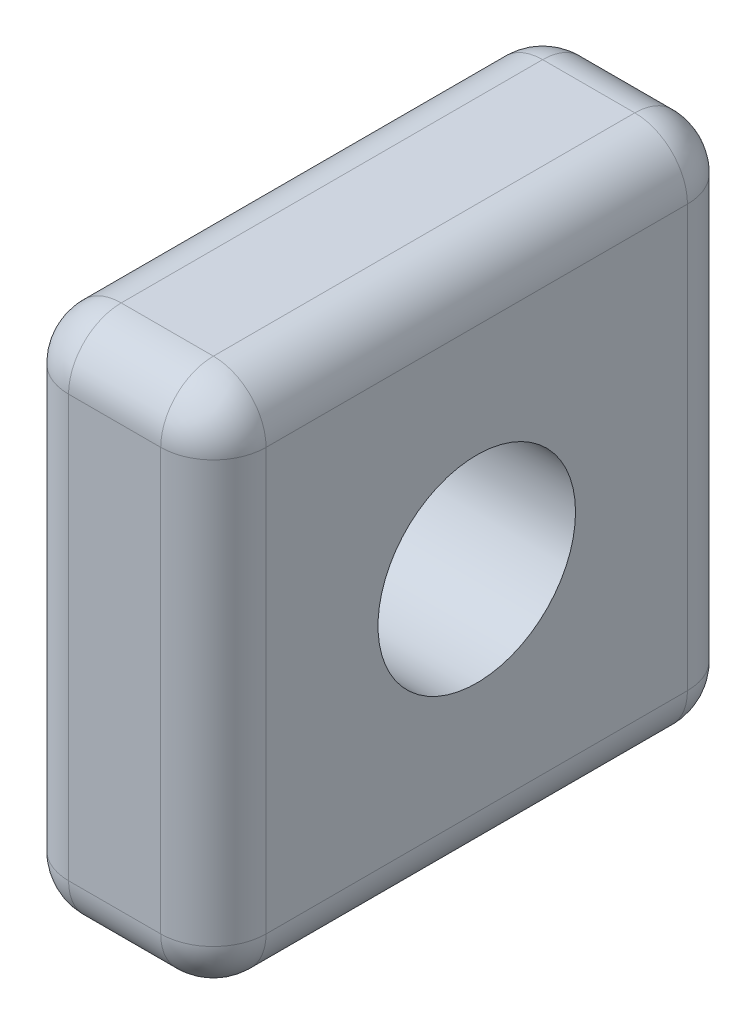
from build123d import *

# Parameters (mm, degrees)
SKETCH2_W           = 12.7
SKETCH2_H           = 12.7
BOSS_EXTRUDE4_DEPTH = 4.7625
SKETCH3_R           = 2.38125
CUT_EXTRUDE1_DEPTH  = 19.581211108
FILLET1_R           = 1.27
FILLET2_R           = 1.27


with BuildPart() as part:
    # Sketch2 → Boss-Extrude4 (new body)
    with BuildSketch(Plane(origin=(0, 0, 0), x_dir=(0, 0, -1), z_dir=(1, 0, 0))):
        with Locations((6.35, 6.35)):
            Rectangle(SKETCH2_W, SKETCH2_H)
    extrude(amount=BOSS_EXTRUDE4_DEPTH)

    # Sketch3 → Cut-Extrude1 (cut, through all)
    with BuildSketch(Plane(origin=(4.7625, 0, 0), x_dir=(0, 0, -1), z_dir=(1, 0, 0))):
        with Locations((6.35, 6.35)):
            Circle(SKETCH3_R)
    extrude(amount=-CUT_EXTRUDE1_DEPTH, mode=Mode.SUBTRACT)

    # Fillet1
    fillet1_edges = [part.edges().sort_by_distance(p)[0] for p in [
        (4.7625, 6.35, -12.7),
        (4.7625, 12.7, -6.35),
        (4.7625, 6.35, 0),
        (4.7625, 0, -6.35),
    ]]
    fillet(fillet1_edges, radius=FILLET1_R)

    # Fillet2
    # the kernel refuses this fillet: 1.27 mm, written as the material it takes off along each edge
    with BuildSketch(Plane(origin=(3.4925, 1.27, -1.27), x_dir=(0, 0, 1), z_dir=(0, -1, 0))) as fillet2_piece_1_section:
        Polygon((0, 0), (FILLET2_R, 0), (FILLET2_R, -FILLET2_R), (0, -FILLET2_R), align=None)
    fillet2_piece_1 = extrude(amount=FILLET2_R, mode=Mode.PRIVATE)
    fillet2_piece_1 = fillet2_piece_1 - Plane(origin=(3.4925, 1.27, -1.27), x_dir=(-0.7071067811865475, 0, -0.7071067811865475), z_dir=(0, -1, 0)) * Sphere(FILLET2_R, mode=Mode.PRIVATE)
    add(fillet2_piece_1, mode=Mode.SUBTRACT)
    with BuildSketch(Plane(origin=(3.4925, 11.43, -1.27), x_dir=(0, 1, 0), z_dir=(0, 0, 1))) as fillet2_piece_2_section:
        Polygon((0, 0), (FILLET2_R, 0), (FILLET2_R, -FILLET2_R), (0, -FILLET2_R), align=None)
    fillet2_piece_2 = extrude(amount=FILLET2_R, mode=Mode.PRIVATE)
    fillet2_piece_2 = fillet2_piece_2 - Plane(origin=(3.4925, 11.43, -1.27), x_dir=(-0.7071067811865475, -0.7071067811865475, 0), z_dir=(0, 0, 1)) * Sphere(FILLET2_R, mode=Mode.PRIVATE)
    add(fillet2_piece_2, mode=Mode.SUBTRACT)
    with BuildSketch(Plane(origin=(3.4925, 1.27, -11.43), x_dir=(0, 0, -1), z_dir=(0, -1, 0))) as fillet2_piece_3_section:
        Polygon((0, 0), (FILLET2_R, 0), (FILLET2_R, FILLET2_R), (0, FILLET2_R), align=None)
    fillet2_piece_3 = extrude(amount=FILLET2_R, mode=Mode.PRIVATE)
    fillet2_piece_3 = fillet2_piece_3 - Plane(origin=(3.4925, 1.27, -11.43), x_dir=(-0.7071067811865475, 0, 0.7071067811865475), z_dir=(0, -1, 0)) * Sphere(FILLET2_R, mode=Mode.PRIVATE)
    add(fillet2_piece_3, mode=Mode.SUBTRACT)
    with BuildSketch(Plane(origin=(3.4925, 11.43, -11.43), x_dir=(0, 1, 0), z_dir=(0, 0, -1))) as fillet2_piece_4_section:
        Polygon((0, 0), (FILLET2_R, 0), (FILLET2_R, FILLET2_R), (0, FILLET2_R), align=None)
    fillet2_piece_4 = extrude(amount=FILLET2_R, mode=Mode.PRIVATE)
    fillet2_piece_4 = fillet2_piece_4 - Plane(origin=(3.4925, 11.43, -11.43), x_dir=(-0.7071067811865475, -0.7071067811865475, 0), z_dir=(0, 0, -1)) * Sphere(FILLET2_R, mode=Mode.PRIVATE)
    add(fillet2_piece_4, mode=Mode.SUBTRACT)
    with BuildSketch(Plane(origin=(1.27, 11.43, -11.43), x_dir=(0, 0, -1), z_dir=(-1, 0, 0))) as fillet2_piece_5_section:
        Polygon((0, 0), (FILLET2_R, 0), (FILLET2_R, -FILLET2_R), (0, -FILLET2_R), align=None)
    fillet2_piece_5 = extrude(amount=FILLET2_R, mode=Mode.PRIVATE)
    fillet2_piece_5 = fillet2_piece_5 - Plane(origin=(1.27, 11.43, -11.43), x_dir=(0, -0.7071067811865475, 0.7071067811865475), z_dir=(-1, 0, 0)) * Sphere(FILLET2_R, mode=Mode.PRIVATE)
    add(fillet2_piece_5, mode=Mode.SUBTRACT)
    with BuildSketch(Plane(origin=(1.27, 1.27, -11.43), x_dir=(-1, 0, 0), z_dir=(0, -1, 0))) as fillet2_piece_6_section:
        Polygon((0, 0), (FILLET2_R, 0), (FILLET2_R, FILLET2_R), (0, FILLET2_R), align=None)
    fillet2_piece_6 = extrude(amount=FILLET2_R, mode=Mode.PRIVATE)
    fillet2_piece_6 = fillet2_piece_6 - Plane(origin=(1.27, 1.27, -11.43), x_dir=(0.7071067811865475, 0, 0.7071067811865475), z_dir=(0, -1, 0)) * Sphere(FILLET2_R, mode=Mode.PRIVATE)
    add(fillet2_piece_6, mode=Mode.SUBTRACT)
    with BuildSketch(Plane(origin=(1.27, 1.27, -1.27), x_dir=(0, 0, 1), z_dir=(0, -1, 0))) as fillet2_piece_7_section:
        Polygon((0, 0), (FILLET2_R, 0), (FILLET2_R, FILLET2_R), (0, FILLET2_R), align=None)
    fillet2_piece_7 = extrude(amount=FILLET2_R, mode=Mode.PRIVATE)
    fillet2_piece_7 = fillet2_piece_7 - Plane(origin=(1.27, 1.27, -1.27), x_dir=(0.7071067811865475, 0, -0.7071067811865475), z_dir=(0, -1, 0)) * Sphere(FILLET2_R, mode=Mode.PRIVATE)
    add(fillet2_piece_7, mode=Mode.SUBTRACT)
    with BuildSketch(Plane(origin=(1.27, 11.43, -1.27), x_dir=(-1, 0, 0), z_dir=(0, 0, 1))) as fillet2_piece_8_section:
        Polygon((0, 0), (FILLET2_R, 0), (FILLET2_R, -FILLET2_R), (0, -FILLET2_R), align=None)
    fillet2_piece_8 = extrude(amount=FILLET2_R, mode=Mode.PRIVATE)
    fillet2_piece_8 = fillet2_piece_8 - Plane(origin=(1.27, 11.43, -1.27), x_dir=(0.7071067811865475, -0.7071067811865475, 0), z_dir=(0, 0, 1)) * Sphere(FILLET2_R, mode=Mode.PRIVATE)
    add(fillet2_piece_8, mode=Mode.SUBTRACT)
    with BuildSketch(Plane(origin=(0, 6.35, -6.35), x_dir=(0, 0, -1), z_dir=(0, -1, 0))) as fillet2_piece_9:
        with BuildLine():
            CenterArc((2.38125 + FILLET2_R, FILLET2_R), FILLET2_R, 180, 90)
            Line((2.38125, FILLET2_R), (2.38125, 0))
            Line((2.38125, 0), (2.38125 + FILLET2_R, 0))
        make_face()
    revolve(axis=Axis((0, 6.35, -6.35), (1, 0, 0)), mode=Mode.SUBTRACT)
    with BuildSketch(Plane(origin=(1.27, 12.7, -12.7), x_dir=(0, -1, 0), z_dir=(1, 0, 0)), Plane(origin=(1.27, 0, -12.7), x_dir=(0, 0, 1), z_dir=(1, 0, 0))) as fillet2_piece_10:
        with BuildLine():
            CenterArc((FILLET2_R, -FILLET2_R), FILLET2_R, 90, 90)
            Line((0, -FILLET2_R), (0, 0))
            Line((0, 0), (FILLET2_R, 0))
        make_face()
    extrude(amount=2.2225, mode=Mode.SUBTRACT)
    with BuildSketch(Plane(origin=(1.27, 0, 0), x_dir=(0, 0, -1), z_dir=(1, 0, 0)), Plane(origin=(1.27, 12.7, 0), x_dir=(0, -1, 0), z_dir=(1, 0, 0))) as fillet2_piece_11:
        with BuildLine():
            CenterArc((FILLET2_R, FILLET2_R), FILLET2_R, 180, 90)
            Line((0, FILLET2_R), (0, 0))
            Line((0, 0), (FILLET2_R, 0))
        make_face()
    extrude(amount=2.2225, mode=Mode.SUBTRACT)
    with BuildSketch(Plane(origin=(0, 12.7, -11.43), x_dir=(0, -1, 0), z_dir=(0, 0, 1)), Plane(origin=(0, 1.27, -12.7), x_dir=(0, 0, 1), z_dir=(0, 1, 0))) as fillet2_piece_12:
        with BuildLine():
            CenterArc((FILLET2_R, FILLET2_R), FILLET2_R, 180, 90)
            Line((0, FILLET2_R), (0, 0))
            Line((0, 0), (FILLET2_R, 0))
        make_face()
    extrude(amount=10.16, mode=Mode.SUBTRACT)
    with BuildSketch(Plane(origin=(0, 0, -1.27), x_dir=(1, 0, 0), z_dir=(0, 0, -1)), Plane(origin=(0, 11.43, 0), x_dir=(1, 0, 0), z_dir=(0, -1, 0))) as fillet2_piece_13:
        with BuildLine():
            CenterArc((FILLET2_R, -FILLET2_R), FILLET2_R, 90, 90)
            Line((0, -FILLET2_R), (0, 0))
            Line((0, 0), (FILLET2_R, 0))
        make_face()
    extrude(amount=10.16, mode=Mode.SUBTRACT)


solid = part.part
